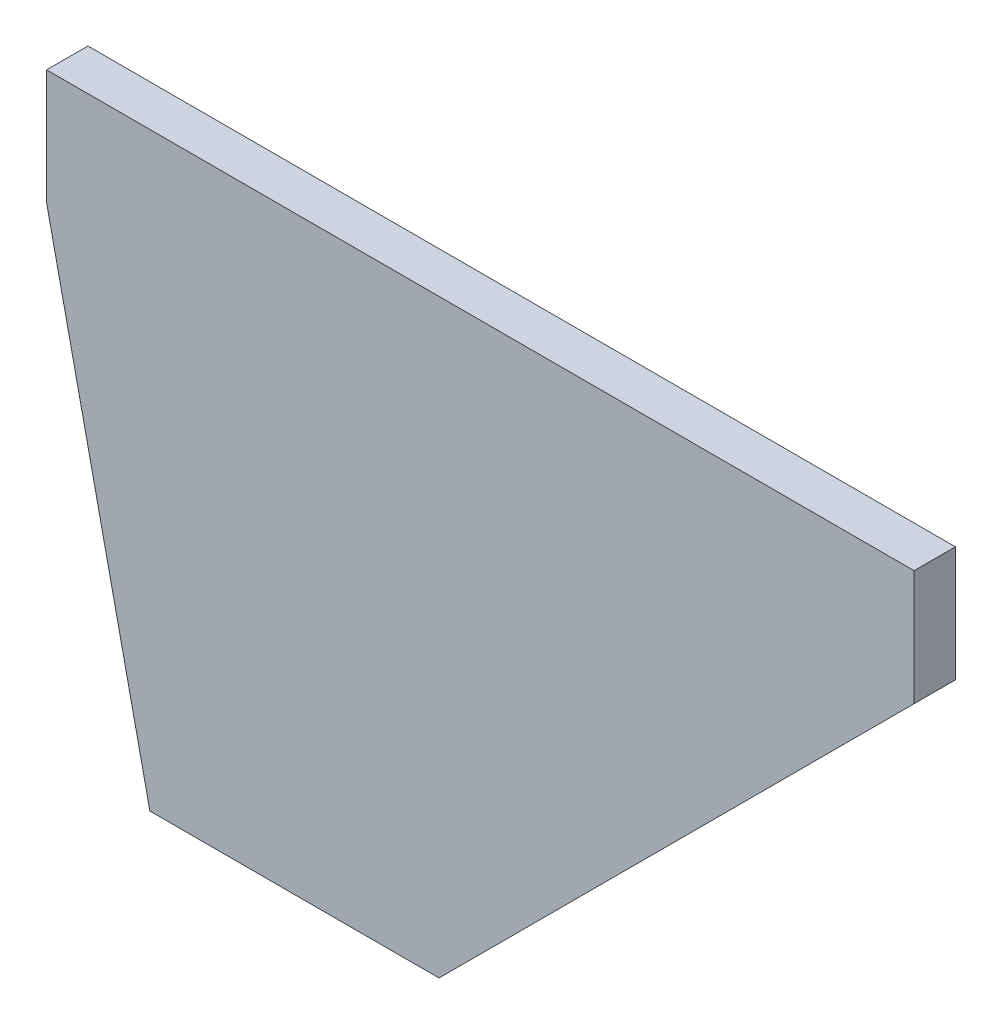
from build123d import *

# Parameters (mm, degrees)
BOSS_EXTRU_1_DEPTH = 5


with BuildPart() as part:
    # Esquisse2 → Boss.-Extru.1 (new, symmetric)
    with BuildSketch(Plane.XY):
        Polygon((-30.197209457, -50.23903484), (-5.197209457, -165.23903484), (64.802790543, -165.23903484), (179.802790543, -50.23903484), (179.802790543, -22.33903484), (-30.197209457, -22.33903484), align=None)
    extrude(amount=BOSS_EXTRU_1_DEPTH, both=True)


solid = part.part
